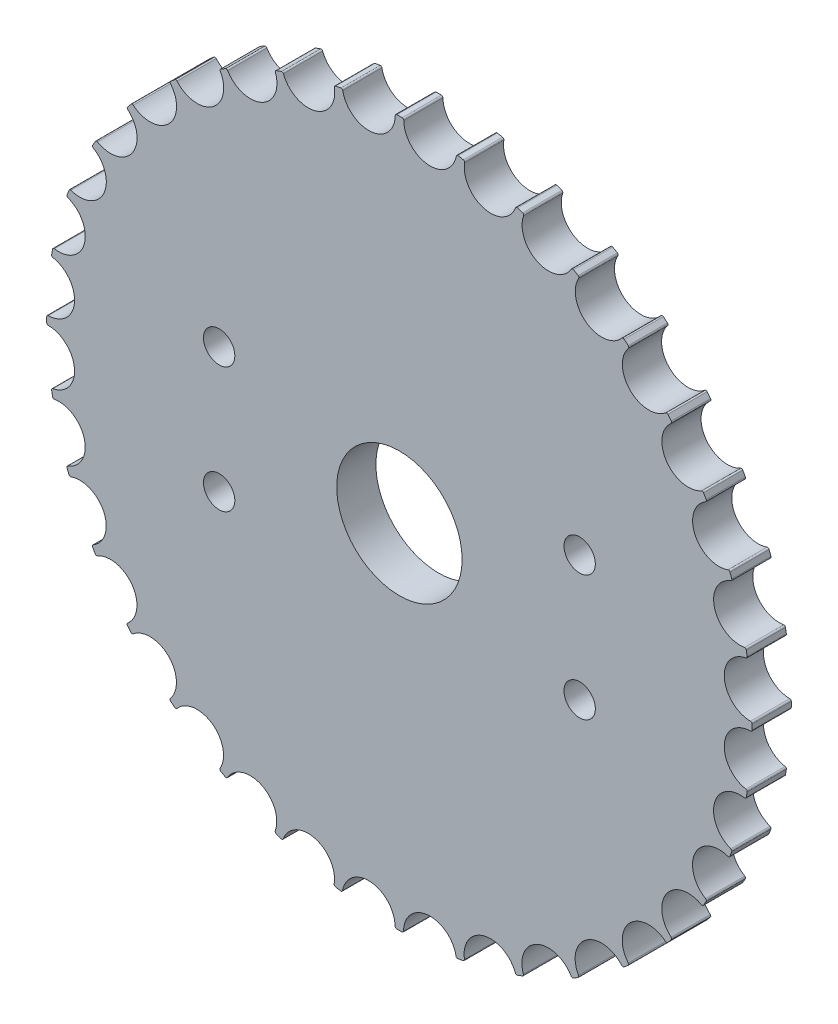
from build123d import *

# Parameters (mm, degrees)
SKETCH_1_R          = 45
EXTRUDE_1_DEPTH     = 5
SKETCH_2_R          = 3.38
CUT_EXTRUDE_2_DEPTH = 50
FILLET_1_R          = 0.2
SKETCH_4_R          = 8
CUT_EXTRUDE_3_DEPTH = 10
SKETCH_5_R          = 2
CUT_EXTRUDE_4_DEPTH = 10


with BuildPart() as part:
    # 스케치1 → 보스-돌출1 (new body)
    with BuildSketch(Plane.XY):
        Circle(SKETCH_1_R)
    extrude(amount=EXTRUDE_1_DEPTH)

    # 스케치2 → 컷-돌출2 (cut)
    with BuildSketch(Plane.XY.offset(5)):
        with Locations((3.93571055, 44.827560523)):
            Circle(SKETCH_2_R)
        with Locations((11.660142457, 43.463100187)):
            Circle(SKETCH_2_R)
        with Locations((19.030286837, 40.778035545)):
            Circle(SKETCH_2_R)
        with Locations((25.82220558, 36.853950928)):
            Circle(SKETCH_2_R)
        with Locations((31.829529673, 31.81007766)):
            Circle(SKETCH_2_R)
        with Locations((36.869729614, 25.79967128)):
            Circle(SKETCH_2_R)
        with Locations((40.789661478, 19.005354943)):
            Circle(SKETCH_2_R)
        with Locations((43.470220118, 11.633570514)):
            Circle(SKETCH_2_R)
        with Locations((44.829958117, 3.908305931)):
            Circle(SKETCH_2_R)
        with Locations((44.827560523, -3.93571055)):
            Circle(SKETCH_2_R)
        with Locations((43.463100187, -11.660142457)):
            Circle(SKETCH_2_R)
        with Locations((40.778035545, -19.030286837)):
            Circle(SKETCH_2_R)
        with Locations((36.853950928, -25.82220558)):
            Circle(SKETCH_2_R)
        with Locations((31.81007766, -31.829529673)):
            Circle(SKETCH_2_R)
        with Locations((25.79967128, -36.869729614)):
            Circle(SKETCH_2_R)
        with Locations((19.005354943, -40.789661478)):
            Circle(SKETCH_2_R)
        with Locations((11.633570514, -43.470220118)):
            Circle(SKETCH_2_R)
        with Locations((3.908305931, -44.829958117)):
            Circle(SKETCH_2_R)
        with Locations((-3.93571055, -44.827560523)):
            Circle(SKETCH_2_R)
        with Locations((-11.660142457, -43.463100187)):
            Circle(SKETCH_2_R)
        with Locations((-19.030286837, -40.778035545)):
            Circle(SKETCH_2_R)
        with Locations((-25.82220558, -36.853950928)):
            Circle(SKETCH_2_R)
        with Locations((-31.829529673, -31.81007766)):
            Circle(SKETCH_2_R)
        with Locations((-36.869729614, -25.79967128)):
            Circle(SKETCH_2_R)
        with Locations((-40.789661478, -19.005354943)):
            Circle(SKETCH_2_R)
        with Locations((-43.470220118, -11.633570514)):
            Circle(SKETCH_2_R)
        with Locations((-44.829958117, -3.908305931)):
            Circle(SKETCH_2_R)
        with Locations((-44.827560523, 3.93571055)):
            Circle(SKETCH_2_R)
        with Locations((-43.463100187, 11.660142457)):
            Circle(SKETCH_2_R)
        with Locations((-40.778035545, 19.030286837)):
            Circle(SKETCH_2_R)
        with Locations((-36.853950928, 25.82220558)):
            Circle(SKETCH_2_R)
        with Locations((-31.81007766, 31.829529673)):
            Circle(SKETCH_2_R)
        with Locations((-25.79967128, 36.869729614)):
            Circle(SKETCH_2_R)
        with Locations((-19.005354943, 40.789661478)):
            Circle(SKETCH_2_R)
        with Locations((-11.633570514, 43.470220118)):
            Circle(SKETCH_2_R)
        with Locations((-3.908305931, 44.829958117)):
            Circle(SKETCH_2_R)
    extrude(amount=-CUT_EXTRUDE_2_DEPTH, mode=Mode.SUBTRACT)

    # 필렛1
    fillet_1_edges = [part.edges().sort_by_distance(p)[0] for p in [
        (44.996516217, -0.559935976, 2.5),
        (44.996850108, 0.532428702, 2.5),
        (44.410149891, 7.262133752, 2.5),
        (44.220791574, 8.337960936, 2.5),
        (42.474403633, 14.863547221, 2.5),
        (42.101106664, 15.890148446, 2.5),
        (39.248094114, 22.013339329, 2.5),
        (38.702200933, 22.959521836, 2.5),
        (34.829251116, 28.49426726, 2.5),
        (34.127348411, 29.331281773, 2.5),
        (29.352138947, 34.1094113, 2.5),
        (28.515553676, 34.811825556, 2.5),
        (22.983176889, 38.688158138, 2.5),
        (22.037328273, 39.234629635, 2.5),
        (44.405702122, -7.289281108, 2.5),
        (44.215686168, -8.364992333, 2.5),
        (42.465309346, -14.889509801, 2.5),
        (42.091384868, -15.915882631, 2.5),
        (39.234629635, -22.037328273, 2.5),
        (38.688158138, -22.983176889, 2.5),
        (34.811825556, -28.515553676, 2.5),
        (34.1094113, -29.352138947, 2.5),
        (29.331281773, -34.127348411, 2.5),
        (28.49426726, -34.829251116, 2.5),
        (22.959521836, -38.702200933, 2.5),
        (22.013339329, -39.248094114, 2.5),
        (15.890148446, -42.101106664, 2.5),
        (14.863547221, -42.474403633, 2.5),
        (8.337960936, -44.220791574, 2.5),
        (7.262133752, -44.410149891, 2.5),
        (0.532428702, -44.996850108, 2.5),
        (-0.559935976, -44.996516217, 2.5),
        (-7.289281108, -44.405702122, 2.5),
        (-8.364992333, -44.215686168, 2.5),
        (-14.889509801, -42.465309346, 2.5),
        (-15.915882631, -42.091384868, 2.5),
        (-22.037328273, -39.234629635, 2.5),
        (-22.983176889, -38.688158138, 2.5),
        (-28.515553676, -34.811825556, 2.5),
        (-29.352138947, -34.1094113, 2.5),
        (-34.127348411, -29.331281773, 2.5),
        (-34.829251116, -28.49426726, 2.5),
        (-38.702200933, -22.959521836, 2.5),
        (-39.248094114, -22.013339329, 2.5),
        (-42.101106664, -15.890148446, 2.5),
        (-42.474403633, -14.863547221, 2.5),
        (-44.220791574, -8.337960936, 2.5),
        (-44.410149891, -7.262133752, 2.5),
        (-44.996850108, -0.532428702, 2.5),
        (-44.996516217, 0.559935976, 2.5),
        (-44.405702122, 7.289281108, 2.5),
        (-44.215686168, 8.364992333, 2.5),
        (-42.465309346, 14.889509801, 2.5),
        (-42.091384868, 15.915882631, 2.5),
        (-39.234629635, 22.037328273, 2.5),
        (-38.688158138, 22.983176889, 2.5),
        (-34.811825556, 28.515553676, 2.5),
        (-34.1094113, 29.352138947, 2.5),
        (-29.331281773, 34.127348411, 2.5),
        (-28.49426726, 34.829251116, 2.5),
        (-22.013339329, 39.248094114, 2.5),
        (-22.959521836, 38.702200933, 2.5),
        (-15.890148446, 42.101106664, 2.5),
        (-14.863547221, 42.474403633, 2.5),
        (-8.337960936, 44.220791574, 2.5),
        (-7.262133752, 44.410149891, 2.5),
        (-0.532428702, 44.996850108, 2.5),
        (0.559935976, 44.996516217, 2.5),
        (7.289281108, 44.405702122, 2.5),
        (8.364992333, 44.215686168, 2.5),
        (14.889509801, 42.465309346, 2.5),
        (15.915882631, 42.091384868, 2.5),
    ]]
    fillet(fillet_1_edges, radius=FILLET_1_R)

    # 스케치4 → 컷-돌출3 (cut)
    with BuildSketch(Plane.XY.offset(5)):
        Circle(SKETCH_4_R)
    extrude(amount=-CUT_EXTRUDE_3_DEPTH, mode=Mode.SUBTRACT)

    # 스케치5 → 컷-돌출4 (cut)
    with BuildSketch(Plane.XY.offset(5)):
        with Locations((-23, 8)):
            Circle(SKETCH_5_R)
        with Locations((23, 8)):
            Circle(SKETCH_5_R)
        with Locations((23, -8)):
            Circle(SKETCH_5_R)
        with Locations((-23, -8)):
            Circle(SKETCH_5_R)
    extrude(amount=-CUT_EXTRUDE_4_DEPTH, mode=Mode.SUBTRACT)


solid = part.part
